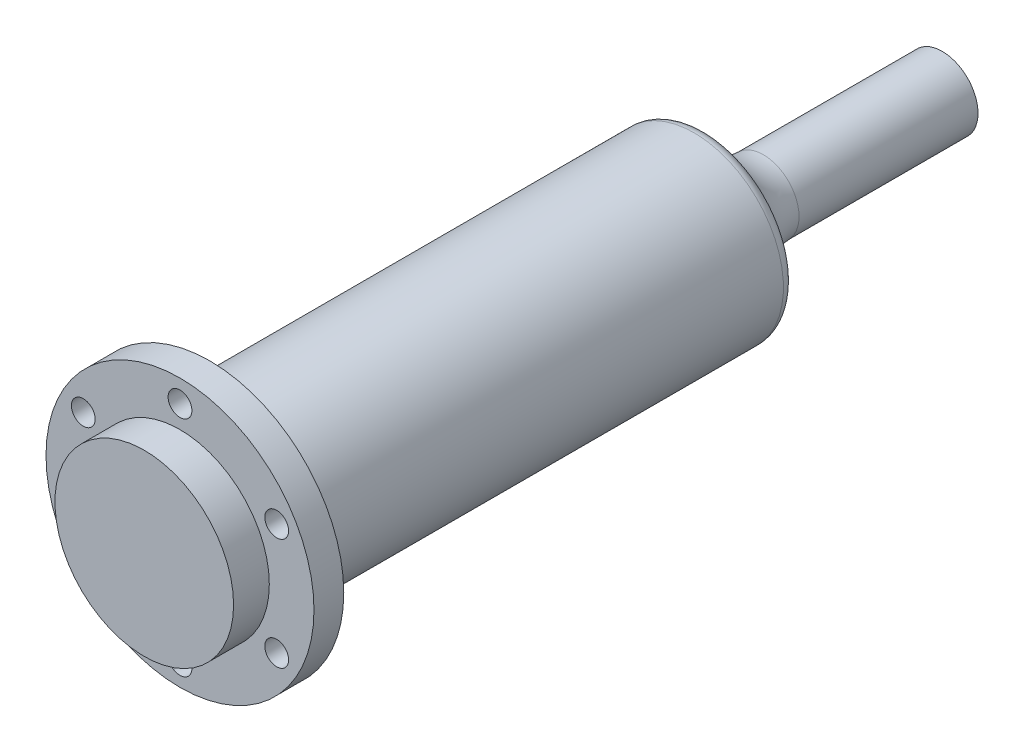
from build123d import *

# Parameters (mm, degrees)
SKETCH1_R             = 15
BOSS_EXTRUDE1_DEPTH   = 77
SKETCH3_R             = 15
SKETCH3_R_2           = 7.5
BOSS_EXTRUDE2_DEPTH   = 17
BOSS_EXTRUDE3_START   = -6
SKETCH4_R             = 22.5
SKETCH4_R_2           = 12.5
SKETCH4_R_3           = 2
BOSS_EXTRUDE3_DEPTH   = 5
SKETCH6_R             = 6
SKETCH6_R_2           = 3
BOSS_EXTRUDE4_DEPTH   = 40
CUT_EXTRUDE2_START    = -72
SKETCH9_R             = 7.5
CUT_EXTRUDE2_DEPTH    = 72
CUT_EXTRUDE3_START    = -5
SKETCH10_R            = 3
CUT_EXTRUDE3_DEPTH    = 5
FILLET1_R             = 10
FILLET2_R             = 2
BOSS_EXTRUDE5_START   = -89
SKETCH12_R            = 7.5
BOSS_EXTRUDE5_DEPTH   = 89
DELETEFACE2_START     = -40
DELETEFACE2_OUTLINE_R = 3
DELETEFACE2_DEPTH     = 45


# Read off the part's stored shape, not the designer's step: DeleteFace2
with BuildPart() as part:
    # Sketch1 → Boss-Extrude1 (new body)
    with BuildSketch(Plane.XY):
        Circle(SKETCH1_R)
    extrude(amount=BOSS_EXTRUDE1_DEPTH)

    # Sketch3 → Boss-Extrude2 (add)
    with BuildSketch(Plane.XY.offset(77)):
        Circle(SKETCH3_R)
        Circle(SKETCH3_R_2, mode=Mode.SUBTRACT)
    extrude(amount=BOSS_EXTRUDE2_DEPTH)

    # Sketch4 → Boss-Extrude3 (add)
    with BuildSketch(Plane.XY.offset(94).offset(BOSS_EXTRUDE3_START)):
        Circle(SKETCH4_R)
        Circle(SKETCH4_R_2, mode=Mode.SUBTRACT)
        with Locations((0, 18.75)):
            Circle(SKETCH4_R_3, mode=Mode.SUBTRACT)
        with Locations((16.237976321, 9.375)):
            Circle(SKETCH4_R_3, mode=Mode.SUBTRACT)
        with Locations((16.237976321, -9.375)):
            Circle(SKETCH4_R_3, mode=Mode.SUBTRACT)
        with Locations((0, -18.75)):
            Circle(SKETCH4_R_3, mode=Mode.SUBTRACT)
        with Locations((-16.237976321, -9.375)):
            Circle(SKETCH4_R_3, mode=Mode.SUBTRACT)
        with Locations((-16.237976321, 9.375)):
            Circle(SKETCH4_R_3, mode=Mode.SUBTRACT)
    extrude(amount=-BOSS_EXTRUDE3_DEPTH)

    # Sketch6 → Boss-Extrude4 (add)
    with BuildSketch(Plane(origin=(0, 0, 0), x_dir=(-1, 0, 0), z_dir=(0, 0, -1))):
        with Locations(Location((0, 0, 0), (0, 0, 180))):
            Circle(SKETCH6_R)
        Circle(SKETCH6_R_2, mode=Mode.SUBTRACT)
    extrude(amount=BOSS_EXTRUDE4_DEPTH)

    # Sketch9 → Cut-Extrude2 (cut)
    with BuildSketch(Plane.XY.offset(77).offset(CUT_EXTRUDE2_START)):
        Circle(SKETCH9_R)
    extrude(amount=CUT_EXTRUDE2_DEPTH, mode=Mode.SUBTRACT)

    # Sketch10 → Cut-Extrude3 (cut)
    with BuildSketch(Plane(origin=(0, 0, 0), x_dir=(-1, 0, 0), z_dir=(0, 0, -1)).offset(CUT_EXTRUDE3_START)):
        with Locations(Location((0, 0, 0), (0, 0, 180))):
            Circle(SKETCH10_R)
    extrude(amount=CUT_EXTRUDE3_DEPTH, mode=Mode.SUBTRACT)

    # Fillet1
    # the kernel refuses this fillet: 10 mm, written as the material it adds along each edge
    with BuildSketch(Plane(origin=(0, 0, 0), x_dir=(1, 0, 0), z_dir=(0, 1, 0))) as fillet1_piece_1:
        with BuildLine():
            CenterArc((16, 9.949874371), FILLET1_R, 180, 84.260829523)
            Line((6, 9.949874371), (5.8, 9.949874371))
            Line((5.8, 9.949874371), (5.8, 0))
            Line((5.8, 0), (6, -0.2))
            ThreePointArc((6, -0.2), (10.5, -0.2), (14.98, -0.198997487))
            Line((14.98, -0.198997487), (15, 0))
        make_face()
    revolve(axis=Axis((0, 0, 0), (0, 0, -1)))

    # Fillet2
    fillet2_edges = [part.edges().sort_by_distance(p)[0] for p in [
        (-15, 0, 0),
    ]]
    fillet(fillet2_edges, radius=FILLET2_R)

    # Sketch12 → Boss-Extrude5 (add)
    with BuildSketch(Plane.XY.offset(94).offset(BOSS_EXTRUDE5_START)):
        Circle(SKETCH12_R)
    extrude(amount=BOSS_EXTRUDE5_DEPTH)

    # DeleteFace2 outline → DeleteFace2 (add)
    with BuildSketch(Plane.XY.offset(DELETEFACE2_START)):
        Circle(DELETEFACE2_OUTLINE_R)
    extrude(amount=DELETEFACE2_DEPTH)


solid = part.part
